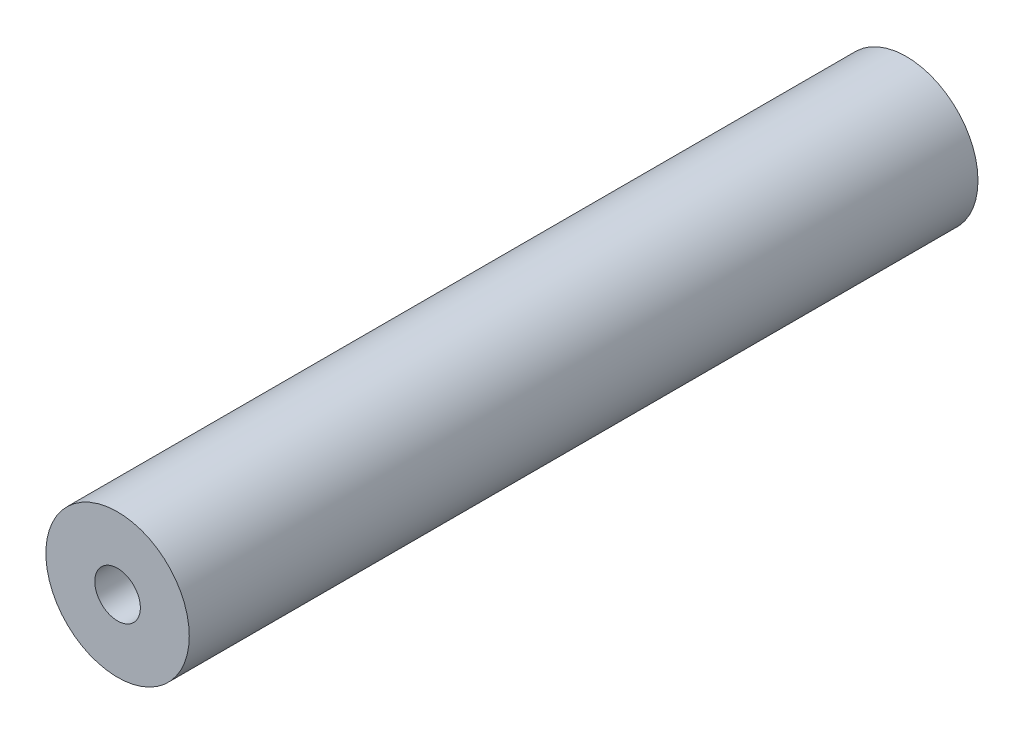
from build123d import *

# Parameters (mm, degrees)
SKETCH1_R           = 6.35
SKETCH1_R_2         = 2.0193
BOSS_EXTRUDE1_DEPTH = 34.925


with BuildPart() as part:
    # Sketch1 → Boss-Extrude1 (new, symmetric)
    with BuildSketch(Plane.XY):
        Circle(SKETCH1_R)
        Circle(SKETCH1_R_2, mode=Mode.SUBTRACT)
    extrude(amount=BOSS_EXTRUDE1_DEPTH, both=True)


solid = part.part
